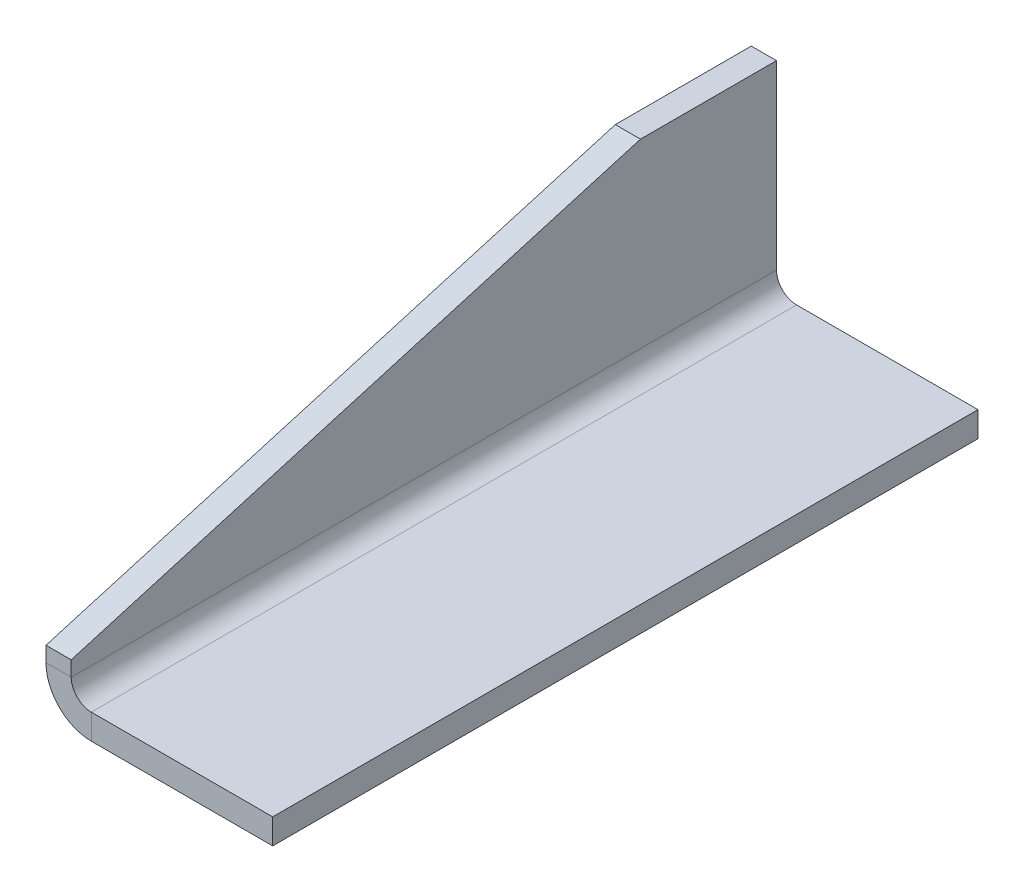
from build123d import *

# Parameters (mm, degrees)
BASE_FLANGE1_DEPTH = 88.9
CUT_EXTRUDE1_DEPTH = 3.175


# Read off the part's stored shape, not the designer's step: Base-Flange1
with BuildPart() as part:
    # Base-Flange1 outline → Base-Flange1 (new body)
    with BuildSketch(Plane.XY):
        with BuildLine():
            Line((2.54, -3.175), (25.4, -3.175))
            Line((25.4, -3.175), (25.4, 0))
            Line((25.4, 0), (2.54, 0))
            ThreePointArc((2.54, 0), (0.743948776, 0.743948776), (0, 2.54))
            Line((0, 2.54), (0, 25.4))
            Line((0, 25.4), (-3.175, 25.4))
            Line((-3.175, 25.4), (-3.175, 2.54))
            ThreePointArc((-3.175, 2.54), (-1.501115254, -1.501115254), (2.54, -3.175))
        make_face()
    extrude(amount=BASE_FLANGE1_DEPTH)

    # Sketch2 → Cut-Extrude1 (cut)
    with BuildSketch(Plane(origin=(0, 0, 0), x_dir=(0, 0, -1), z_dir=(1, 0, 0))):
        Polygon((-88.9, 25.4), (-88.9, 4.445), (-17.145, 25.4), align=None)
    extrude(amount=-CUT_EXTRUDE1_DEPTH, mode=Mode.SUBTRACT)


solid = part.part
